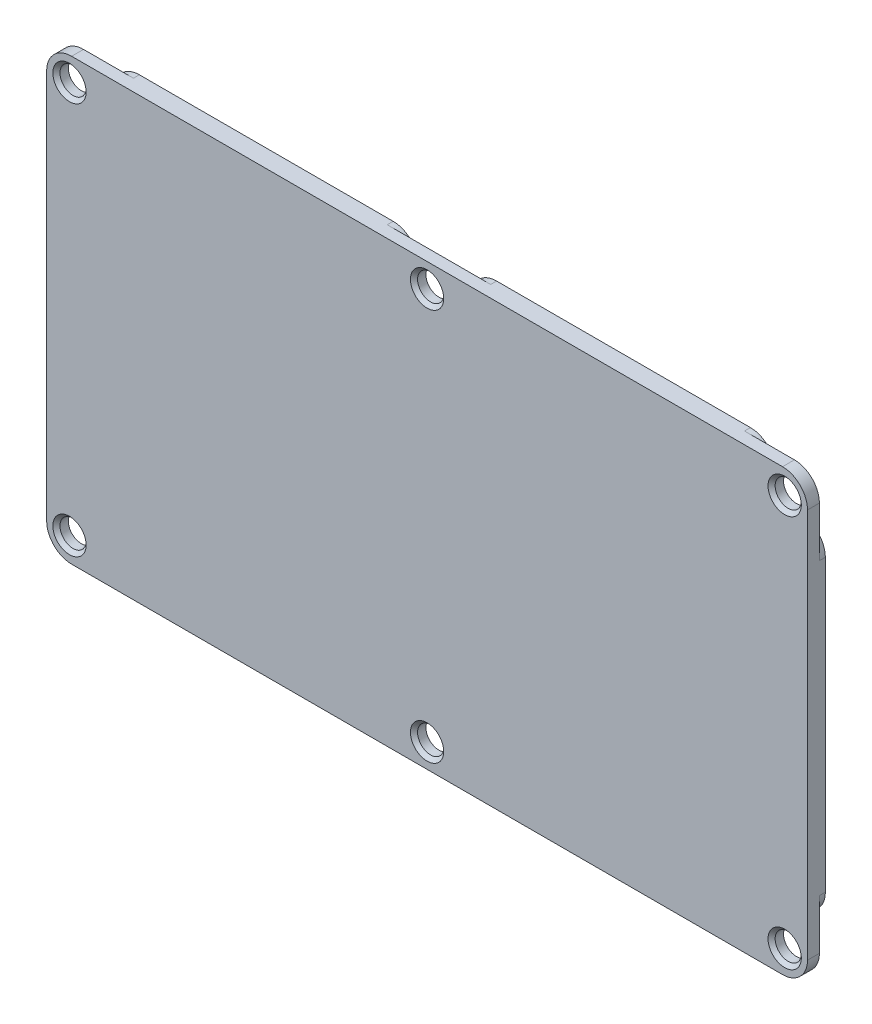
from build123d import *

# Parameters (mm, degrees)
SKETCH_1_W          = 64
SKETCH_1_H          = 37
EXTRUDE_1_DEPTH     = 1
SKETCH_2_W          = 4.2
SKETCH_2_H          = 28.6
SKETCH_2_W_2        = 25.55
SKETCH_2_H_2        = 4.2
SKETCH_2_W_3        = 4.5
EXTRUDE_2_DEPTH     = 0.5
FILLET_1_R          = 2.1
CUT_EXTRUDE_1_REACH = 38.993
SKETCH_3_R          = 1.1
CHAMFER_1_SIZE      = 0.3


with BuildPart() as part:
    # 스케치1 → 보스-돌출1 (new body)
    with BuildSketch(Plane.XY):
        Rectangle(SKETCH_1_W, SKETCH_1_H)
    extrude(amount=EXTRUDE_1_DEPTH)

    # 스케치2 → 보스-돌출2 (add)
    with BuildSketch(Plane(origin=(0, 0, 0), x_dir=(-1, 0, 0), z_dir=(0, 0, -1))):
        with Locations((-29.9, 0)):
            Rectangle(SKETCH_2_W, SKETCH_2_H)
        with Locations((-15.025, 0)):
            Rectangle(SKETCH_2_W_2, SKETCH_2_H)
        with Locations((-15.025, 16.4)):
            Rectangle(SKETCH_2_W_2, SKETCH_2_H_2)
        with Locations((-15.025, -16.4)):
            Rectangle(SKETCH_2_W_2, SKETCH_2_H_2)
        with Locations((15.025, 0)):
            Rectangle(SKETCH_2_W_2, SKETCH_2_H)
        with Locations((15.025, 16.4)):
            Rectangle(SKETCH_2_W_2, SKETCH_2_H_2)
        Rectangle(SKETCH_2_W_3, SKETCH_2_H)
        with Locations((29.9, 0)):
            Rectangle(SKETCH_2_W, SKETCH_2_H)
        with Locations((15.025, -16.4)):
            Rectangle(SKETCH_2_W_2, SKETCH_2_H_2)
    extrude(amount=EXTRUDE_2_DEPTH)

    # 필렛1
    # the kernel refuses this fillet: 2.1 mm, written as the material it adds along each edge
    with BuildSketch(Plane(origin=(27.8, -14.3, 5.25), x_dir=(0, -1, 0), z_dir=(0, 0, -1))) as fillet_1_piece_1_section:
        with BuildLine():
            CenterArc((FILLET_1_R, -FILLET_1_R), FILLET_1_R, 90, 90)
            Line((0, -FILLET_1_R), (0, 0))
            Line((0, 0), (FILLET_1_R, 0))
        make_face()
    fillet_1_piece_1 = extrude(amount=5.75, mode=Mode.PRIVATE)
    fillet_1_piece_1 = split(fillet_1_piece_1, bisect_by=Plane(origin=(28.269072672, -14.769072672, 1), z_dir=(0, 0, -1)), keep=Keep.TOP, mode=Mode.PRIVATE)
    add(fillet_1_piece_1)
    with BuildSketch(Plane(origin=(-2.25, -14.3, 5.25), x_dir=(0, -1, 0), z_dir=(0, 0, -1))) as fillet_1_piece_2_section:
        with BuildLine():
            CenterArc((FILLET_1_R, -FILLET_1_R), FILLET_1_R, 90, 90)
            Line((0, -FILLET_1_R), (0, 0))
            Line((0, 0), (FILLET_1_R, 0))
        make_face()
    fillet_1_piece_2 = extrude(amount=5.75, mode=Mode.PRIVATE)
    fillet_1_piece_2 = split(fillet_1_piece_2, bisect_by=Plane(origin=(-1.780927328, -14.769072672, 1), z_dir=(0, 0, -1)), keep=Keep.TOP, mode=Mode.PRIVATE)
    add(fillet_1_piece_2)
    with BuildSketch(Plane(origin=(2.25, -14.3, 5.25), x_dir=(-1, 0, 0), z_dir=(0, 0, -1))) as fillet_1_piece_3_section:
        with BuildLine():
            CenterArc((FILLET_1_R, -FILLET_1_R), FILLET_1_R, 90, 90)
            Line((0, -FILLET_1_R), (0, 0))
            Line((0, 0), (FILLET_1_R, 0))
        make_face()
    fillet_1_piece_3 = extrude(amount=5.75, mode=Mode.PRIVATE)
    fillet_1_piece_3 = split(fillet_1_piece_3, bisect_by=Plane(origin=(1.780927328, -14.769072672, 1), z_dir=(0, 0, -1)), keep=Keep.TOP, mode=Mode.PRIVATE)
    add(fillet_1_piece_3)
    with BuildSketch(Plane(origin=(-27.8, -14.3, 5.25), x_dir=(-1, 0, 0), z_dir=(0, 0, -1))) as fillet_1_piece_4_section:
        with BuildLine():
            CenterArc((FILLET_1_R, -FILLET_1_R), FILLET_1_R, 90, 90)
            Line((0, -FILLET_1_R), (0, 0))
            Line((0, 0), (FILLET_1_R, 0))
        make_face()
    fillet_1_piece_4 = extrude(amount=5.75, mode=Mode.PRIVATE)
    fillet_1_piece_4 = split(fillet_1_piece_4, bisect_by=Plane(origin=(-28.269072672, -14.769072672, 1), z_dir=(0, 0, -1)), keep=Keep.TOP, mode=Mode.PRIVATE)
    add(fillet_1_piece_4)
    with BuildSketch(Plane(origin=(27.8, 14.3, 0), x_dir=(1, 0, 0), z_dir=(0, 0, -1)), Plane(origin=(-27.8, 14.3, 0), x_dir=(0, 1, 0), z_dir=(0, 0, -1))) as fillet_1_piece_5:
        with BuildLine():
            CenterArc((FILLET_1_R, -FILLET_1_R), FILLET_1_R, 90, 90)
            Line((0, -FILLET_1_R), (0, 0))
            Line((0, 0), (FILLET_1_R, 0))
        make_face()
    extrude(amount=0.5)
    with BuildSketch(Plane(origin=(-2.25, 14.3, 0), x_dir=(0, 1, 0), z_dir=(0, 0, -1)), Plane(origin=(2.25, 14.3, 0), x_dir=(-1, 0, 0), z_dir=(0, 0, -1))) as fillet_1_piece_6:
        with BuildLine():
            CenterArc((FILLET_1_R, FILLET_1_R), FILLET_1_R, 180, 90)
            Line((0, FILLET_1_R), (0, 0))
            Line((0, 0), (FILLET_1_R, 0))
        make_face()
    extrude(amount=0.5)
    # the kernel refuses this fillet: 2.1 mm, written as the material it takes off along each edge
    with BuildSketch(Plane(origin=(32, -18.5, -5.25), x_dir=(-1, 0, 0), z_dir=(0, 0, 1)), Plane(origin=(32, 18.5, -5.25), x_dir=(0, -1, 0), z_dir=(0, 0, 1))) as fillet_1_2_piece_1:
        with BuildLine():
            CenterArc((FILLET_1_R, -FILLET_1_R), FILLET_1_R, 90, 90)
            Line((0, -FILLET_1_R), (0, 0))
            Line((0, 0), (FILLET_1_R, 0))
        make_face()
    extrude(amount=11.5, mode=Mode.SUBTRACT)
    with BuildSketch(Plane(origin=(32, -14.3, 0), x_dir=(0, 1, 0), z_dir=(0, 0, -1)), Plane(origin=(27.8, 18.5, 0), x_dir=(-1, 0, 0), z_dir=(0, 0, -1)), Plane(origin=(-2.25, 18.5, 0), x_dir=(-1, 0, 0), z_dir=(0, 0, -1)), Plane(origin=(2.25, -18.5, 0), x_dir=(1, 0, 0), z_dir=(0, 0, -1)), Plane(origin=(-27.8, -18.5, 0), x_dir=(1, 0, 0), z_dir=(0, 0, -1)), Plane(origin=(-32, 14.3, 0), x_dir=(0, -1, 0), z_dir=(0, 0, -1))) as fillet_1_2_piece_2:
        with BuildLine():
            CenterArc((FILLET_1_R, -FILLET_1_R), FILLET_1_R, 90, 90)
            Line((0, -FILLET_1_R), (0, 0))
            Line((0, 0), (FILLET_1_R, 0))
        make_face()
    extrude(amount=5.75, mode=Mode.SUBTRACT)
    with BuildSketch(Plane(origin=(-32, -14.3, 0), x_dir=(0, 1, 0), z_dir=(0, 0, -1)), Plane(origin=(27.8, -18.5, 0), x_dir=(-1, 0, 0), z_dir=(0, 0, -1)), Plane(origin=(-2.25, -18.5, 0), x_dir=(-1, 0, 0), z_dir=(0, 0, -1)), Plane(origin=(2.25, 18.5, 0), x_dir=(1, 0, 0), z_dir=(0, 0, -1)), Plane(origin=(-27.8, 18.5, 0), x_dir=(1, 0, 0), z_dir=(0, 0, -1)), Plane(origin=(32, 14.3, 0), x_dir=(0, -1, 0), z_dir=(0, 0, -1))) as fillet_1_2_piece_3:
        with BuildLine():
            CenterArc((FILLET_1_R, FILLET_1_R), FILLET_1_R, 180, 90)
            Line((0, FILLET_1_R), (0, 0))
            Line((0, 0), (FILLET_1_R, 0))
        make_face()
    extrude(amount=5.75, mode=Mode.SUBTRACT)
    with BuildSketch(Plane(origin=(-32, -18.5, -5.25), x_dir=(1, 0, 0), z_dir=(0, 0, 1)), Plane(origin=(-32, 18.5, -5.25), x_dir=(0, -1, 0), z_dir=(0, 0, 1))) as fillet_1_2_piece_4:
        with BuildLine():
            CenterArc((FILLET_1_R, FILLET_1_R), FILLET_1_R, 180, 90)
            Line((0, FILLET_1_R), (0, 0))
            Line((0, 0), (FILLET_1_R, 0))
        make_face()
    extrude(amount=11.5, mode=Mode.SUBTRACT)

    # 스케치3 → 컷-돌출1 (cut, up to next)
    with BuildSketch(Plane.XY.offset(1), mode=Mode.PRIVATE) as cut_extrude_1_sk1:
        with Locations((-30.08, 16.5)):
            Circle(SKETCH_3_R)
    cut_extrude_1_tool1 = extrude(cut_extrude_1_sk1.sketch, amount=-CUT_EXTRUDE_1_REACH, mode=Mode.PRIVATE) & part.part
    # 스케치3 → 컷-돌출1 (cut, up to next)
    with BuildSketch(Plane.XY.offset(1), mode=Mode.PRIVATE) as cut_extrude_1_sk2:
        with Locations((0, 16.5)):
            Circle(SKETCH_3_R)
    cut_extrude_1_tool2 = extrude(cut_extrude_1_sk2.sketch, amount=-CUT_EXTRUDE_1_REACH, mode=Mode.PRIVATE) & part.part
    # 스케치3 → 컷-돌출1 (cut, up to next)
    with BuildSketch(Plane.XY.offset(1), mode=Mode.PRIVATE) as cut_extrude_1_sk3:
        with Locations((30.08, 16.5)):
            Circle(SKETCH_3_R)
    cut_extrude_1_tool3 = extrude(cut_extrude_1_sk3.sketch, amount=-CUT_EXTRUDE_1_REACH, mode=Mode.PRIVATE) & part.part
    # 스케치3 → 컷-돌출1 (cut, up to next)
    with BuildSketch(Plane.XY.offset(1), mode=Mode.PRIVATE) as cut_extrude_1_sk4:
        with Locations((30.08, -16.5)):
            Circle(SKETCH_3_R)
    cut_extrude_1_tool4 = extrude(cut_extrude_1_sk4.sketch, amount=-CUT_EXTRUDE_1_REACH, mode=Mode.PRIVATE) & part.part
    # 스케치3 → 컷-돌출1 (cut, up to next)
    with BuildSketch(Plane.XY.offset(1), mode=Mode.PRIVATE) as cut_extrude_1_sk5:
        with Locations((-30.08, -16.5)):
            Circle(SKETCH_3_R)
    cut_extrude_1_tool5 = extrude(cut_extrude_1_sk5.sketch, amount=-CUT_EXTRUDE_1_REACH, mode=Mode.PRIVATE) & part.part
    # 스케치3 → 컷-돌출1 (cut, up to next)
    with BuildSketch(Plane.XY.offset(1), mode=Mode.PRIVATE) as cut_extrude_1_sk6:
        with Locations((0, -16.5)):
            Circle(SKETCH_3_R)
    cut_extrude_1_tool6 = extrude(cut_extrude_1_sk6.sketch, amount=-CUT_EXTRUDE_1_REACH, mode=Mode.PRIVATE) & part.part
    add(cut_extrude_1_tool1.solids().sort_by_distance((-30.08, 16.5, 1))[0], mode=Mode.SUBTRACT)
    add(cut_extrude_1_tool2.solids().sort_by_distance((0, 16.5, 1))[0], mode=Mode.SUBTRACT)
    add(cut_extrude_1_tool3.solids().sort_by_distance((30.08, 16.5, 1))[0], mode=Mode.SUBTRACT)
    add(cut_extrude_1_tool4.solids().sort_by_distance((30.08, -16.5, 1))[0], mode=Mode.SUBTRACT)
    add(cut_extrude_1_tool5.solids().sort_by_distance((-30.08, -16.5, 1))[0], mode=Mode.SUBTRACT)
    add(cut_extrude_1_tool6.solids().sort_by_distance((0, -16.5, 1))[0], mode=Mode.SUBTRACT)

    # 모따기1
    chamfer_1_edges = [part.edges().sort_by_distance(p)[0] for p in [
        (-1.1, 16.5, 1),
        (28.98, 16.5, 1),
        (28.98, -16.5, 1),
        (-31.18, -16.5, 1),
        (-1.1, -16.5, 1),
        (-31.18, 16.5, 1),
    ]]
    chamfer(chamfer_1_edges, length=CHAMFER_1_SIZE)


solid = part.part
